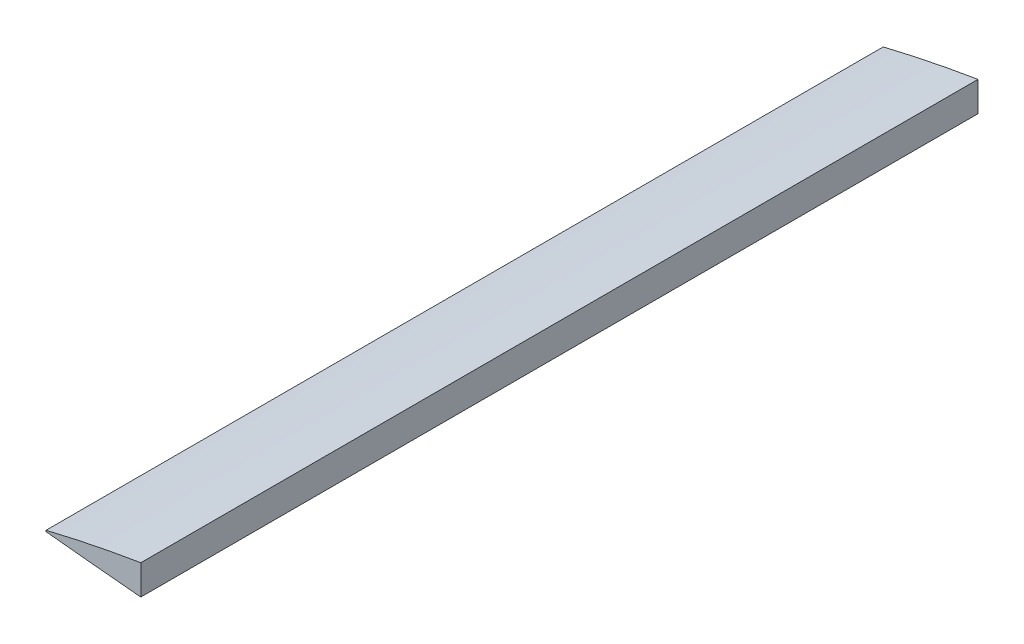
from build123d import *

# Parameters (mm, degrees)
BOSS_EXTRUDE1_DEPTH = 612
SKETCH2_W           = 21
SKETCH2_H           = 11.5
CUT_EXTRUDE1_DEPTH  = 13


with BuildPart() as part:
    # Sketch1 → Boss-Extrude1 (new body)
    with BuildSketch(Plane.XY):
        with BuildLine():
            Line((-197.26698, 14.545556384), (-197.26698, -7.208910553))
            add(Edge.make_bspline(
                [(-197.26698, -7.208910553), (-199.019685082, -7.050017591), (-203.678439199, -6.627674295), (-211.084107985, -5.939566862), (-219.309277242, -5.164758413), (-227.009246775, -4.426989792), (-234.135070336, -3.733626285), (-240.641108589, -3.09072516), (-246.485492991, -2.504721762), (-251.630355083, -1.980998363), (-256.042317783, -1.527359301), (-259.692220923, -1.143575744), (-262.556904408, -0.849913683), (-264.61546863, -0.612861211), (-265.858416096, -0.512805201), (-266.419029816, -0.418366575), (-266.567688701, -0.418895711), (-266.577, -0.418928854)],
                knots=[0, 0, 0, 0, 0.075810952, 0.201508279, 0.320388141, 0.43169539, 0.534719075, 0.628797147, 0.713321079, 0.787740393, 0.851567051, 0.904379655, 0.945827345, 0.975633259, 0.993597432, 0.999598973, 1, 1, 1, 1], degree=3))
            Line((-266.577, -0.418928854), (-266.577, 0.425749675))
            add(Edge.make_bspline(
                [(-197.26698, 14.545556384), (-199.291263309, 14.209823561), (-204.216747599, 13.392918764), (-211.867868306, 12.029944562), (-220.046716751, 10.510857765), (-227.684960434, 9.024190881), (-234.737637437, 7.595336861), (-241.162806841, 6.244958614), (-246.922671776, 4.994209984), (-251.983535287, 3.863074945), (-256.315994171, 2.870269339), (-259.895031115, 2.032695679), (-262.700108493, 1.365039117), (-264.715189951, 0.879184388), (-265.919534871, 0.586380331), (-266.450919413, 0.456553449), (-266.577, 0.425749675)],
                knots=[0, 0, 0, 0, 0.087007005, 0.211705365, 0.329527113, 0.439740645, 0.541660709, 0.634652346, 0.718134669, 0.791584505, 0.854539888, 0.906603358, 0.947445002, 0.976805146, 0.994496602, 1, 1, 1, 1], degree=3))
        make_face()
    extrude(amount=-BOSS_EXTRUDE1_DEPTH)

    # Sketch2 → Cut-Extrude1 (cut)
    with BuildSketch(Plane.XY.offset(-96.9)):
        with Locations((-209.932, -2.027)):
            Rectangle(SKETCH2_W, SKETCH2_H)
    extrude(amount=CUT_EXTRUDE1_DEPTH, mode=Mode.SUBTRACT)


solid = part.part
